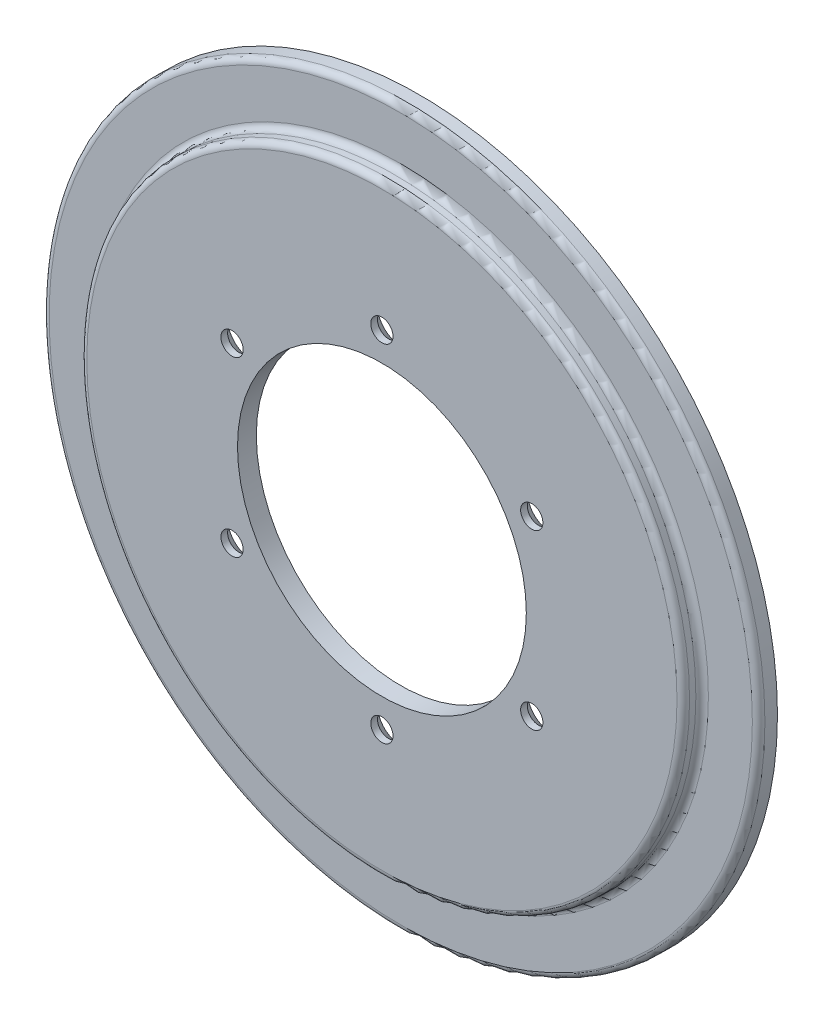
from build123d import *

# Parameters (mm, degrees)
CIRPATTERN2_COUNT = 6


with BuildPart() as part:
    # Sketch3 → Revolve1 (revolve)
    with BuildSketch(Plane(origin=(0, 0, 0), x_dir=(0, 0, -1), z_dir=(1, 0, 0))):
        with BuildLine():
            Line((0, 29.21), (0, 59.69))
            ThreePointArc((0, 59.69), (0.371974388, 60.588025612), (1.27, 60.96))
            Line((1.27, 60.96), (2.54, 60.96))
            ThreePointArc((2.54, 60.96), (3.438025612, 61.331974388), (3.81, 62.23))
            Line((3.81, 62.23), (3.81, 71.12))
            ThreePointArc((3.81, 71.12), (4.181974388, 72.018025612), (5.08, 72.39))
            Line((5.08, 72.39), (7.62, 72.39))
            Line((7.62, 72.39), (7.62, 58.42))
            ThreePointArc((7.62, 58.42), (7.248025612, 57.521974388), (6.35, 57.15))
            Line((6.35, 57.15), (5.08, 57.15))
            ThreePointArc((5.08, 57.15), (4.181974388, 56.778025612), (3.81, 55.88))
            Line((3.81, 55.88), (3.81, 29.21))
            Line((3.81, 29.21), (0, 29.21))
        make_face()
    revolve(axis=Axis((0, 0, 0), (0, 0, -1)))

    # Sketch7 → CSK for M4 Countersunk Flat Head Screw2 (revolve, cut)
    with BuildSketch(Plane(origin=(0, 35, -3.81), x_dir=(0, 1, 0), z_dir=(1, 0, 0))):
        Polygon((0, 0), (0, 5.161936393), (2.25, 3.81), (2.25, 2.45), (4.7, 0), align=None)
    csk_for_m4_countersunk_flat_head_screw2 = revolve(axis=Axis((0, 35, -10.16), (0, 0, 1)), mode=Mode.SUBTRACT)

    # CirPattern2: CSK for M4 Countersunk Flat Head Screw2 ×6 about axis
    cirpattern2_axis = Axis((0, 0, -3.81), (0, 0, 1))
    for i in range(1, CIRPATTERN2_COUNT):
        add(csk_for_m4_countersunk_flat_head_screw2.rotate(cirpattern2_axis, i * 360 / CIRPATTERN2_COUNT), mode=Mode.SUBTRACT)


solid = part.part
